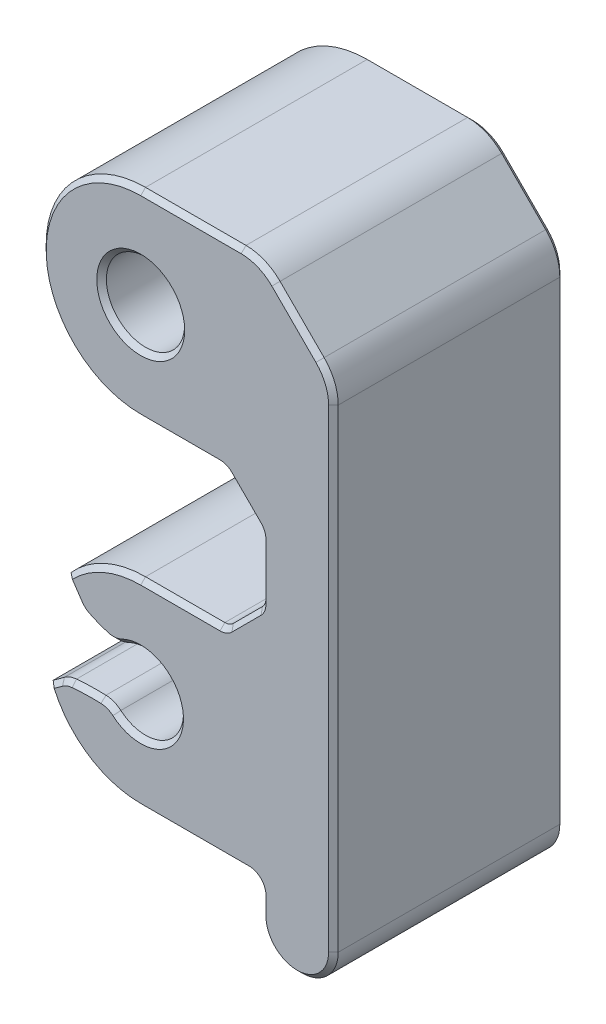
from build123d import *

# Parameters (mm, degrees)
SKETCH2_R                         = 1.575
SKETCH2_R_2                       = 1.625
BOSS_EXTRUDE1_DEPTH               = 5
LATCH_NOTCH_DEPTH                 = 21.433199089
LATCH_NOTCH_DEPTH_BACK            = 21.433199089
FILLET2_R                         = 1
THUMB_BUMP_LONG_REACH             = 22.433
THUMB_BUMP_LONG_DIRECTION_2_REACH = 22.433
FILLET6_R                         = 0.5
MOVEMENT_CLEARANCE_DEPTH          = 0.2
FILLET3_R                         = 2
FILLET4_R                         = 0.5
CHAMFER2_SIZE                     = 0.2


with BuildPart() as part:
    # Sketch2 → Boss-Extrude1 (new, symmetric)
    with BuildSketch(Plane.XY):
        with BuildLine():
            Line((8, -15.125), (8, 1.125))
            Line((8, 1.125), (5, 4.125))
            Line((5, 4.125), (0, 4.125))
            ThreePointArc((0, 4.125), (-4.125, 0), (0, -4.125))
            Line((0, -4.125), (3.5, -4.125))
            Line((3.5, -4.125), (5, -5.625))
            Line((5, -5.625), (5, -8.375))
            Line((5, -8.375), (3.5, -9.875))
            Line((3.5, -9.875), (0, -9.875))
            ThreePointArc((0, -9.875), (-4.125, -14), (0, -18.125))
            Line((0, -18.125), (5, -18.125))
            Line((5, -18.125), (8, -15.125))
        make_face()
        with Locations((0, -14)):
            Circle(SKETCH2_R, mode=Mode.SUBTRACT)
        Circle(SKETCH2_R_2, mode=Mode.SUBTRACT)
    extrude(amount=BOSS_EXTRUDE1_DEPTH, both=True)

    # Sketch3 → Latch Notch (cut, two sides: drawn at the far end of the back side and taken through both)
    with BuildSketch(Plane.XY.offset(-LATCH_NOTCH_DEPTH_BACK)):
        with BuildLine():
            Line((-5.189425986, -13.053442339), (-4.352006159, -10.311715335))
            ThreePointArc((-4.352006159, -10.311715335), (-2.519069602, -12.169061048), (0, -12.85))
            Line((0, -12.85), (0, -15.15))
            ThreePointArc((0, -15.15), (-3.063481939, -15.004958499), (-6.026845813, -15.795169343))
            Line((-6.026845813, -15.795169343), (-5.189425986, -13.053442339))
        make_face()
    extrude(amount=LATCH_NOTCH_DEPTH + LATCH_NOTCH_DEPTH_BACK, mode=Mode.SUBTRACT)

    # Chamfer1
    # the kernel refuses this chamfer: 1.535901437, 0.897551306, 0.4 mm, written as the material it takes off along each edge
    with BuildSketch(Plane(origin=(-3.336286816, -11.574136179, -7.844626154), x_dir=(0.8125376228226495, -0.5829087505756949, 0), z_dir=(0, 0, 1))) as chamfer1_piece_1:
        with BuildLine():
            Line((1.080053984, 0), (0.021291111, 0.393036797))
            ThreePointArc((0.021291111, 0.393036797), (0.006455038, 0.205821568), (0, 0))
            ThreePointArc((0, 0), (0.568931585, -0.029164914), (1.080053984, 0))
        make_face()
    extrude(amount=15.689252309, mode=Mode.SUBTRACT)
    with BuildSketch(Plane(origin=(-3.96348247, -15.142992437, -7.141629453), x_dir=(0.3226160511275448, -0.9465299168831746, 0), z_dir=(0, 0, 1))) as chamfer1_piece_2:
        with BuildLine():
            Line((0.393613053, 0), (0.141125799, 0.8123737))
            ThreePointArc((0.141125799, 0.8123737), (0.064933685, 0.423381867), (0, 0))
            ThreePointArc((0, 0), (0.202118313, -0.004694141), (0.393613053, 0))
        make_face()
    extrude(amount=14.283258906, mode=Mode.SUBTRACT)

    # Fillet2
    fillet2_edges = [part.edges().sort_by_distance(p)[0] for p in [
        (-1.235054025, -14.977377387, 0),
        (-0.965763736, -12.755843496, 0),
        (-3.149017011, -15.014487433, 0),
        (-2.45870232, -12.203709097, 0),
    ]]
    fillet(fillet2_edges, radius=FILLET2_R)

    # Thumb Bump LONG: up to this face of the body (flat: up to its plane)
    thumb_bump_long_end = Plane(part.part.faces().sort_by_distance((-2.247358014, -15.204704165, 5))[0])
    # Sketch6 → Thumb Bump LONG (add, up to the picked face)
    with BuildSketch(Plane.XY, mode=Mode.PRIVATE) as thumb_bump_long_sk1:
        with BuildLine():
            Line((8, -15.125), (8, -19.375))
            ThreePointArc((8, -19.375), (6.5, -20.875), (5, -19.375))
            Line((5, -19.375), (5, -18.125))
            Line((5, -18.125), (8, -15.125))
        make_face()
    thumb_bump_long_tool1 = split(extrude(thumb_bump_long_sk1.sketch, amount=THUMB_BUMP_LONG_REACH, mode=Mode.PRIVATE), bisect_by=thumb_bump_long_end, keep=Keep.BOTH, mode=Mode.PRIVATE)
    add(thumb_bump_long_tool1.solids().sort_by(Axis((6.690932, -18.50785, 0), (0, 0, 1)))[0])

    # Thumb Bump LONG direction 2: up to this face of the body (flat: up to its plane)
    thumb_bump_long_direction_2_end = Plane(part.part.faces().sort_by_distance((-2.247358014, -15.204704165, -5))[0])
    # Sketch6 → Thumb Bump LONG direction 2 (add, up to the picked face)
    with BuildSketch(Plane.XY, mode=Mode.PRIVATE) as thumb_bump_long_direction_2_sk1:
        with BuildLine():
            Line((8, -15.125), (8, -19.375))
            ThreePointArc((8, -19.375), (6.5, -20.875), (5, -19.375))
            Line((5, -19.375), (5, -18.125))
            Line((5, -18.125), (8, -15.125))
        make_face()
    thumb_bump_long_direction_2_tool1 = split(extrude(thumb_bump_long_direction_2_sk1.sketch, amount=-THUMB_BUMP_LONG_DIRECTION_2_REACH, mode=Mode.PRIVATE), bisect_by=thumb_bump_long_direction_2_end, keep=Keep.BOTH, mode=Mode.PRIVATE)
    add(thumb_bump_long_direction_2_tool1.solids().sort_by(Axis((6.690932, -18.50785, 0), (0, 0, -1)))[0])

    # Fillet6
    fillet6_edges = [part.edges().sort_by_distance(p)[0] for p in [
        (5, -18.125, 0),
    ]]
    fillet(fillet6_edges, radius=FILLET6_R)

    # Sketch5 → Movement Clearance (cut)
    with BuildSketch(Plane.XY.offset(5)):
        with BuildLine():
            Line((-3.367662745, -15.173848028), (-3.836496581, -15.515558967))
            ThreePointArc((-3.836496581, -15.515558967), (-2.319907785, -17.410814107), (0, -18.125))
            Line((0, -18.125), (4.5, -18.125))
            ThreePointArc((4.5, -18.125), (4.853553391, -18.271446609), (5, -18.625))
            Line((5, -18.625), (5, -19.375))
            ThreePointArc((5, -19.375), (6.5, -20.875), (8, -19.375))
            Line((8, -19.375), (8, 1.125))
            Line((8, 1.125), (5, 4.125))
            Line((5, 4.125), (0, 4.125))
            ThreePointArc((0, 4.125), (-4.125, 0), (0, -4.125))
            Line((0, -4.125), (3.5, -4.125))
            Line((3.5, -4.125), (5, -5.625))
            Line((5, -5.625), (5, -8.375))
            Line((5, -8.375), (3.5, -9.875))
            Line((3.5, -9.875), (0, -9.875))
            ThreePointArc((0, -9.875), (-1.694518043, -10.239117976), (-3.089882399, -11.267189769))
            Line((-3.089882399, -11.267189769), (-2.598457721, -11.996345718))
            ThreePointArc((-2.598457721, -11.996345718), (-2.427061693, -12.190611517), (-2.211513476, -12.334329174))
            ThreePointArc((-2.211513476, -12.334329174), (-1.819392443, -12.507232133), (-1.413905836, -12.645922256))
            ThreePointArc((-1.413905836, -12.645922256), (-1.047175867, -12.683207874), (-0.691852953, -12.585092055))
            ThreePointArc((-0.691852953, -12.585092055), (1.562261425, -14.19991058), (-1.025836674, -15.195108412))
            ThreePointArc((-1.025836674, -15.195108412), (-1.313167774, -15.022506023), (-1.641393845, -14.954547274))
            ThreePointArc((-1.641393845, -14.954547274), (-2.253812991, -14.951393788), (-2.865276684, -14.985734846))
            ThreePointArc((-2.865276684, -14.985734846), (-3.129319301, -15.04547458), (-3.367662745, -15.173848028))
        make_face()
    movement_clearance = extrude(amount=-MOVEMENT_CLEARANCE_DEPTH, mode=Mode.SUBTRACT)

    # Movement Clearance 2: Movement Clearance across plane
    add(movement_clearance.mirror(Plane.XY), mode=Mode.SUBTRACT)

    # Fillet3
    fillet3_edges = [part.edges().sort_by_distance(p)[0] for p in [
        (5, 4.125, 0),
        (8, 1.125, 0),
    ]]
    fillet(fillet3_edges, radius=FILLET3_R)

    # Fillet4
    fillet4_edges = [part.edges().sort_by_distance(p)[0] for p in [
        (3.5, -9.875, 0),
        (5, -8.375, 0),
        (5, -5.625, 0),
        (3.5, -4.125, 0),
    ]]
    fillet(fillet4_edges, radius=FILLET4_R)

    # Chamfer2
    chamfer2_edges = [part.edges().sort_by_distance(p)[0] for p in [
        (-2.319907785, -17.410814107, 4.8),
        (-3.602079663, -15.344703498, 4.8),
        (-3.129319301, -15.04547458, 4.8),
        (-2.253812991, -14.951393788, 4.8),
        (-1.313167774, -15.022506023, 4.8),
        (1.562261425, -14.19991058, 4.8),
        (-1.047175867, -12.683207874, 4.8),
        (-1.819392443, -12.507232133, 4.8),
        (-2.427061693, -12.190611517, 4.8),
        (-2.84417006, -11.631767743, 4.8),
        (-1.694518043, -10.239117976, 4.8),
        (1.646446609, -4.125, 4.8),
        (-4.125, 0, 4.8),
        (8, -9.539213562, 4.8),
        (6.5, -20.875, 4.8),
        (5, -19, 4.8),
        (4.853553391, -18.271446609, 4.8),
        (2.25, -18.125, 4.8),
        (-1.625, 0, 4.8),
        (-1.625, 0, -4.8),
        (-2.319907785, -17.410814107, -4.8),
        (2.25, -18.125, -4.8),
        (4.853553391, -18.271446609, -4.8),
        (5, -19, -4.8),
        (6.5, -20.875, -4.8),
        (8, -9.539213562, -4.8),
        (-4.125, 0, -4.8),
        (1.646446609, -4.125, -4.8),
        (-1.694518043, -10.239117976, -4.8),
        (-2.84417006, -11.631767743, -4.8),
        (-2.427061693, -12.190611517, -4.8),
        (-1.819392443, -12.507232133, -4.8),
        (-1.047175867, -12.683207874, -4.8),
        (1.562261425, -14.19991058, -4.8),
        (-1.313167774, -15.022506023, -4.8),
        (-2.253812991, -14.951393788, -4.8),
        (-3.129319301, -15.04547458, -4.8),
        (-3.602079663, -15.344703498, -4.8),
        (6.5, 2.625, -4.8),
        (6.5, 2.625, 4.8),
        (2.085786438, 4.125, -4.8),
        (4.93693974, 3.972759065, -4.8),
        (7.847759065, 1.06193974, -4.8),
        (2.085786438, 4.125, 4.8),
        (4.93693974, 3.972759065, 4.8),
        (7.847759065, 1.06193974, 4.8),
        (1.646446609, -9.875, -4.8),
        (1.646446609, -9.875, 4.8),
        (4.25, -9.125, -4.8),
        (4.25, -9.125, 4.8),
        (5, -7, -4.8),
        (5, -7, 4.8),
        (4.25, -4.875, -4.8),
        (4.25, -4.875, 4.8),
        (3.484234935, -9.836939766, -4.8),
        (3.484234935, -9.836939766, 4.8),
        (4.961939766, -8.359234935, -4.8),
        (4.961939766, -8.359234935, 4.8),
        (4.961939766, -5.640765065, -4.8),
        (4.961939766, -5.640765065, 4.8),
        (3.484234935, -4.163060234, -4.8),
        (3.484234935, -4.163060234, 4.8),
    ]]
    chamfer(chamfer2_edges, length=CHAMFER2_SIZE)


solid = part.part
